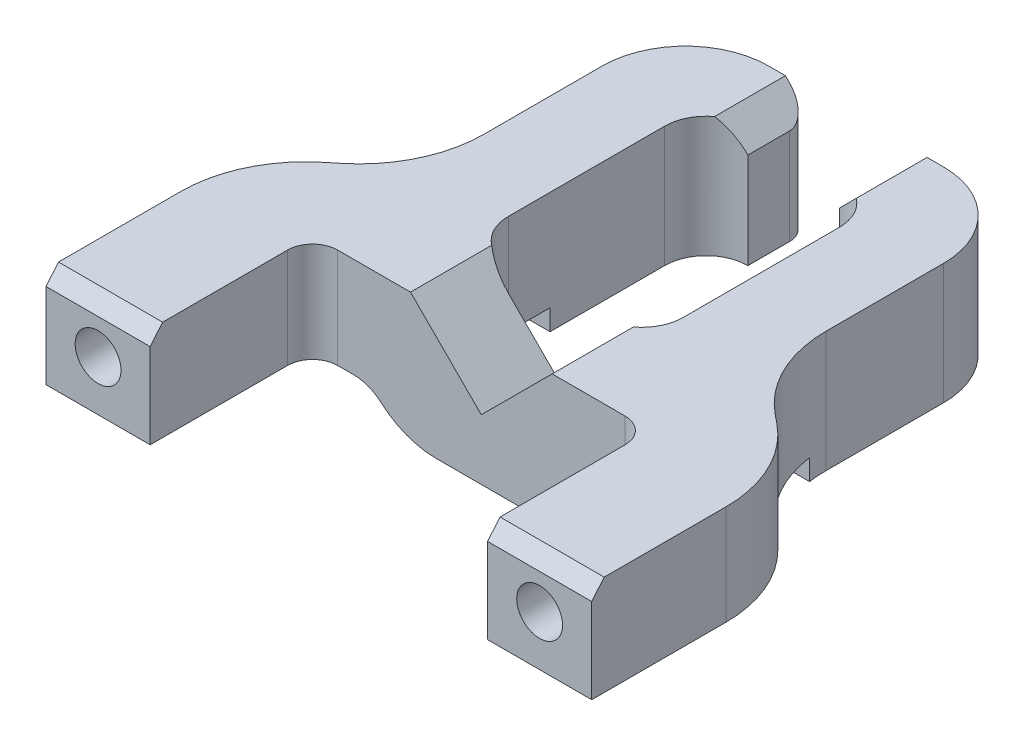
from build123d import *
from OCP.BRepFilletAPI import BRepFilletAPI_MakeChamfer

# Parameters (mm, degrees)
BOSS_EXTRUDE1_DEPTH     = 2.4
CUT_EXTRUDE1_DEPTH      = 15.66535032
CUT_EXTRUDE1_DEPTH_BACK = 2.1
SKETCH4_R               = 0.55
CUT_EXTRUDE2_START      = -9
CUT_EXTRUDE2_DEPTH      = 9
SKETCH6_W               = 4.2
SKETCH6_H               = 1.75
BOSS_EXTRUDE2_DEPTH     = 0.75
BOSS_EXTRUDE3_DEPTH     = 0.5
FILLET1_R               = 1
FILLET2_R               = 2
FILLET3_R               = 1
FILLET4_R               = 2
FILLET6_R               = 0.5
FILLET8_R               = 0.6
FILLET9_R               = 3
FILLET10_R              = 3
CHAMFER1_SIZE           = 0.3
CHAMFER1_SIZE2          = 0.357526078


# Read off the part's stored shape, not the designer's step: Cut-Extrude2
# Some blends are built 0.0001 mm under size
with BuildPart() as part:
    # Sketch1 → Boss-Extrude1 (new body)
    with BuildSketch(Plane(origin=(0, 0, 0), x_dir=(1, 0, 0), z_dir=(0, 1, 0))):
        Polygon((-2.1, 0), (-2.1, 5.75), (-1.1, 5.75), (-1.1, 7.25), (-2.1, 7.25), (-4.1, 7.25), (-4.1, 1), (-6.55, -1), (-6.55, -5.65), (-4.05, -5.65), (-4.05, -1.75), (4.05, -1.75), (4.05, -5.65), (6.55, -5.65), (6.55, -1), (4.1, 1), (4.1, 7.25), (2.1, 7.25), (1.1, 7.25), (1.1, 5.75), (2.1, 5.75), (2.1, 0), align=None)
    extrude(amount=BOSS_EXTRUDE1_DEPTH)

    # Sketch4 → Cut-Extrude1 (cut, two sides: drawn at the far end of the back side and taken through both)
    with BuildSketch(Plane.XY.offset(5.65).offset(-CUT_EXTRUDE1_DEPTH_BACK)):
        with Locations((-5.3, 1.2)):
            Circle(SKETCH4_R)
        with Locations(Location((5.3, 1.2, 0), (0, 0, 180))):
            Circle(SKETCH4_R)
    extrude(amount=CUT_EXTRUDE1_DEPTH + CUT_EXTRUDE1_DEPTH_BACK, mode=Mode.SUBTRACT)

    # Cut-Extrude2 outline → Cut-Extrude2 (cut)
    with BuildSketch(Plane.XY.offset(1.75).offset(CUT_EXTRUDE2_START)):
        Polygon((-1.700147862, 2.4), (0, 0.699852138), (1.700147862, 2.4), align=None)
    extrude(amount=CUT_EXTRUDE2_DEPTH, mode=Mode.SUBTRACT)

    # Sketch6 → Boss-Extrude2 (add)
    with BuildSketch(Plane.XZ):
        with Locations((0, 0.875)):
            Rectangle(SKETCH6_W, SKETCH6_H)
    extrude(amount=BOSS_EXTRUDE2_DEPTH)

    # Sketch7 → Boss-Extrude3 (add)
    with BuildSketch(Plane.XZ):
        Polygon((-2.1, -5.75), (-1.1, -5.75), (-1.1, -7.25), (-4.1, -7.25), (-4.1, -2), (-2.1, -2), align=None)
        Polygon((4.1, -2), (2.1, -2), (2.1, -5.75), (1.1, -5.75), (1.1, -7.25), (4.1, -7.25), align=None)
    extrude(amount=BOSS_EXTRUDE3_DEPTH)

    # Fillet1
    # the kernel refuses this fillet: 1 mm, written as the material it adds along each edge
    with BuildSketch(Plane(origin=(-2.1, 0, 1.75), x_dir=(-1, 0, 0), z_dir=(0, 0, -1))) as fillet1_piece_1:
        with BuildLine():
            CenterArc((0.968245837, -1), FILLET1_R, 90, 75.522487814)
            Line((0, -0.75), (0, 0))
            Line((0, 0), (0.968245837, 0))
        make_face()
    extrude(amount=1.75)
    with BuildSketch(Plane(origin=(2.1, 0, 0), x_dir=(0, -1, 0), z_dir=(0, 0, 1))) as fillet1_piece_2:
        with BuildLine():
            CenterArc((1, 0.968245837), FILLET1_R, 180, 75.522487814)
            Line((0, 0.968245837), (0, 0))
            Line((0, 0), (0.75, 0))
        make_face()
    extrude(amount=1.75)

    # Fillet2
    fillet2_edges = [part.edges().sort_by_distance(p)[0] for p in [
        (-2.1, -0.75, 0.875),
        (2.1, -0.75, 0.875),
    ]]
    fillet(fillet2_edges, radius=FILLET2_R)

    # Fillet3
    fillet3_edges = [part.edges().sort_by_distance(p)[0] for p in [
        (-2.1, 0.95, -5.75),
        (2.1, 0.95, -5.75),
        (-2.1, 1.2, 0),
        (2.1, 1.2, 0),
    ]]
    fillet(fillet3_edges, radius=FILLET3_R - 0.0001)  # a hair under: the kernel refuses the full size

    # Fillet4
    fillet4_edges = [part.edges().sort_by_distance(p)[0] for p in [
        (-4.1, 0.95, -7.25),
        (4.1, 0.95, -7.25),
    ]]
    fillet(fillet4_edges, radius=FILLET4_R)

    # Fillet6
    fillet6_edges = [part.edges().sort_by_distance(p)[0] for p in [
        (-1.1, 0.649926069, -7.25),
        (1.1, 0.649926069, -7.25),
    ]]
    fillet(fillet6_edges, radius=FILLET6_R)

    # Fillet8
    fillet8_edges = [part.edges().sort_by_distance(p)[0] for p in [
        (-4.05, 1.2, 1.75),
        (4.05, 1.2, 1.75),
    ]]
    fillet(fillet8_edges, radius=FILLET8_R)

    # Fillet9
    fillet9_edges = [part.edges().sort_by_distance(p)[0] for p in [
        (-6.55, 1.2, 1),
        (6.55, 1.2, 1),
    ]]
    fillet(fillet9_edges, radius=FILLET9_R)

    # Fillet10
    fillet10_edges = [part.edges().sort_by_distance(p)[0] for p in [
        (-4.1, 1.2, -1),
        (4.1, 1.2, -1),
    ]]
    fillet(fillet10_edges, radius=FILLET10_R)

    # Chamfer1: one chamfer whose edges measure the first distance from different faces: ONE call of the kernel's chamfer builder (chamfer() names one face for all edges)
    chamfer1_edges_1 = [part.edges().sort_by_distance(p)[0] for p in [
        (5.3, 2.4, 5.65),
    ]]
    chamfer1_side_1 = [part.faces().sort_by_distance(p)[0] for p in [
        (3.921880383, 2.4, -0.274216986),
    ]]
    chamfer1_edges_2 = [part.edges().sort_by_distance(p)[0] for p in [
        (-5.3, 2.4, 5.65),
    ]]
    chamfer1_side_2 = [part.faces().sort_by_distance(p)[0] for p in [
        (-3.921880383, 2.4, -0.274216986),
    ]]
    chamfer1 = BRepFilletAPI_MakeChamfer(part.part.solid().wrapped)
    for e in chamfer1_edges_1:
        chamfer1.Add(CHAMFER1_SIZE, CHAMFER1_SIZE2, e.wrapped, chamfer1_side_1[0].wrapped)  # the first distance lies on this face
    for e in chamfer1_edges_2:
        chamfer1.Add(CHAMFER1_SIZE, CHAMFER1_SIZE2, e.wrapped, chamfer1_side_2[0].wrapped)  # the first distance lies on this face
    add(Compound.cast(chamfer1.Shape()), mode=Mode.REPLACE)


solid = part.part
